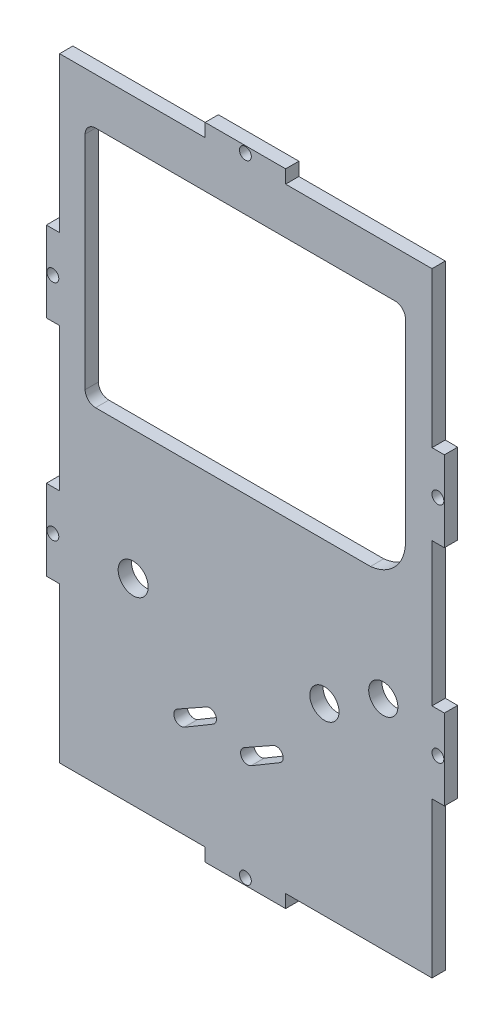
from build123d import *

# Parameters (mm, degrees)
SKETCH1_7_W             = 89.29
SKETCH1_7_H             = 147.294272307
SKETCH1_7_R             = 3.6
SKETCH1_7_R_2           = 3.5
BODY_DEPTH              = 3.18
SKETCH2_W               = 19.3
SKETCH2_H               = 3.18
BOSS_EXTRUDE1_DEPTH     = 3.18
SKETCH3_R               = 1.425
CUT_EXTRUDE1_DEPTH      = 89.95245291
SKETCH4_W               = 3.18
SKETCH4_H               = 19.3
BOSS_EXTRUDE2_DEPTH     = 3.18
SKETCH5_R               = 1.425
CUT_EXTRUDE2_DEPTH      = 91.482140695
MIRROR2_COPY_1_SKETCH_W = 3.18
MIRROR2_COPY_1_SKETCH_H = 19.3
MIRROR2_COPY_1_DEPTH    = 3.18
MIRROR2_COPY_2_SKETCH_R = 1.425
MIRROR2_COPY_2_DEPTH    = 91.482140695
MIRROR2_COPY_3_SKETCH_W = 3.18
MIRROR2_COPY_3_SKETCH_H = 19.3
MIRROR2_COPY_3_DEPTH    = 3.18
MIRROR2_COPY_4_SKETCH_R = 1.425
MIRROR2_COPY_4_DEPTH    = 91.482140695


with BuildPart() as part:
    # Sketch1<7> → Body (new body)
    with BuildSketch(Plane.XY):
        with Locations((0.105848892, -0.017058674)):
            Rectangle(SKETCH1_7_W, SKETCH1_7_H)
        with BuildLine():
            ThreePointArc((-14.641551271, -51.285483428), (-16.940439708, -50.641794665), (-16.296750946, -48.342906228))
            Line((-16.296750946, -48.342906228), (-9.324146649, -44.420816311))
            ThreePointArc((-9.324146649, -44.420816311), (-7.152105158, -45.022980632), (-7.741744524, -47.198455643))
            Line((-7.741744524, -47.198455643), (-14.641551271, -51.285483428))
        make_face(mode=Mode.SUBTRACT)
        with Locations((-26.900831216, -26.517202566)):
            Circle(SKETCH1_7_R, mode=Mode.SUBTRACT)
        with BuildLine():
            ThreePointArc((1.358448729, -51.285483428), (-0.940439708, -50.641794665), (-0.296750946, -48.342906228))
            Line((-0.296750946, -48.342906228), (6.675853351, -44.420816311))
            ThreePointArc((6.675853351, -44.420816311), (8.847894842, -45.022980632), (8.258255476, -47.198455643))
            Line((8.258255476, -47.198455643), (1.358448729, -51.285483428))
        make_face(mode=Mode.SUBTRACT)
        with Locations((18.957561099, -29.561304194)):
            Circle(SKETCH1_7_R_2, mode=Mode.SUBTRACT)
        with Locations((33.068305831, -21.491722051)):
            Circle(SKETCH1_7_R_2, mode=Mode.SUBTRACT)
        with BuildLine():
            Line((-35.919151108, 62.490077479), (35.889642662, 62.490077479))
            ThreePointArc((35.889642662, 62.490077479), (37.657409615, 61.757844432), (38.389642662, 59.990077479))
            Line((38.389642662, 59.990077479), (38.389642662, 13.668014642))
            ThreePointArc((38.389642662, 13.668014642), (35.990372343, 7.41277043), (29.997375098, 4.418014642))
            Line((29.997375098, 4.418014642), (-35.919151108, 4.418014642))
            ThreePointArc((-35.919151108, 4.418014642), (-37.686918061, 5.150247689), (-38.419151108, 6.918014642))
            Line((-38.419151108, 6.918014642), (-38.419151108, 59.990077479))
            ThreePointArc((-38.419151108, 59.990077479), (-37.686918061, 61.757844432), (-35.919151108, 62.490077479))
        make_face(mode=Mode.SUBTRACT)
    extrude(amount=BODY_DEPTH)

    # Sketch2 → Boss-Extrude1 (add)
    with BuildSketch(Plane(origin=(0, 73.630077479, 0), x_dir=(1, 0, 0), z_dir=(0, 1, 0))):
        with Locations((0, -1.59)):
            Rectangle(SKETCH2_W, SKETCH2_H)
    boss_extrude1 = extrude(amount=BOSS_EXTRUDE1_DEPTH)

    # Sketch3 → Cut-Extrude1 (cut, through all)
    with BuildSketch(Plane.XY.offset(3.18)):
        with Locations((0, 75.220077479)):
            Circle(SKETCH3_R)
    cut_extrude1 = extrude(amount=-CUT_EXTRUDE1_DEPTH, mode=Mode.SUBTRACT)

    # Sketch4 → Boss-Extrude2 (add)
    with BuildSketch(Plane.ZY.offset(44.539151108)):
        with Locations((1.59, 26.810077479)):
            Rectangle(SKETCH4_W, SKETCH4_H)
    boss_extrude2 = extrude(amount=BOSS_EXTRUDE2_DEPTH)

    # Sketch5 → Cut-Extrude2 (cut, through all)
    with BuildSketch(Plane.XY.offset(3.18)):
        with Locations((-46.161220751, 26.810077479)):
            Circle(SKETCH5_R)
    cut_extrude2 = extrude(amount=-CUT_EXTRUDE2_DEPTH, mode=Mode.SUBTRACT)

    # Mirror1: Boss-Extrude2, Cut-Extrude2 across plane
    add(boss_extrude2.mirror(Plane(origin=(0, 0, 0), x_dir=(0, 0, 1), z_dir=(1, 0, 0))))
    add(cut_extrude2.mirror(Plane(origin=(0, 0, 0), x_dir=(0, 0, 1), z_dir=(1, 0, 0))), mode=Mode.SUBTRACT)

    # Mirror2: Boss-Extrude1, Cut-Extrude1 across plane
    add(boss_extrude1.mirror(Plane.ZX))
    add(cut_extrude1.mirror(Plane.ZX), mode=Mode.SUBTRACT)

    # Mirror2 copy 1 sketch → Mirror2 copy 1 (add)
    with BuildSketch(Plane(origin=(44.539151108, 0, 0), x_dir=(0, 0, 1), z_dir=(1, 0, 0))):
        with Locations((1.59, 26.810077479)):
            Rectangle(MIRROR2_COPY_1_SKETCH_W, MIRROR2_COPY_1_SKETCH_H)
    extrude(amount=MIRROR2_COPY_1_DEPTH)

    # Mirror2 copy 2 sketch → Mirror2 copy 2 (cut, through all)
    with BuildSketch(Plane(origin=(0, 0, 3.18), x_dir=(-1, 0, 0), z_dir=(0, 0, 1))):
        with Locations((-46.161220751, 26.810077479)):
            Circle(MIRROR2_COPY_2_SKETCH_R)
    extrude(amount=-MIRROR2_COPY_2_DEPTH, mode=Mode.SUBTRACT)

    # Mirror2 copy 3 sketch → Mirror2 copy 3 (add)
    with BuildSketch(Plane.ZY.offset(44.539151108)):
        with Locations((1.59, -26.810077479)):
            Rectangle(MIRROR2_COPY_3_SKETCH_W, MIRROR2_COPY_3_SKETCH_H)
    extrude(amount=MIRROR2_COPY_3_DEPTH)

    # Mirror2 copy 4 sketch → Mirror2 copy 4 (cut, through all)
    with BuildSketch(Plane.XY.offset(3.18)):
        with Locations((-46.161220751, -26.810077479)):
            Circle(MIRROR2_COPY_4_SKETCH_R)
    extrude(amount=-MIRROR2_COPY_4_DEPTH, mode=Mode.SUBTRACT)


solid = part.part
